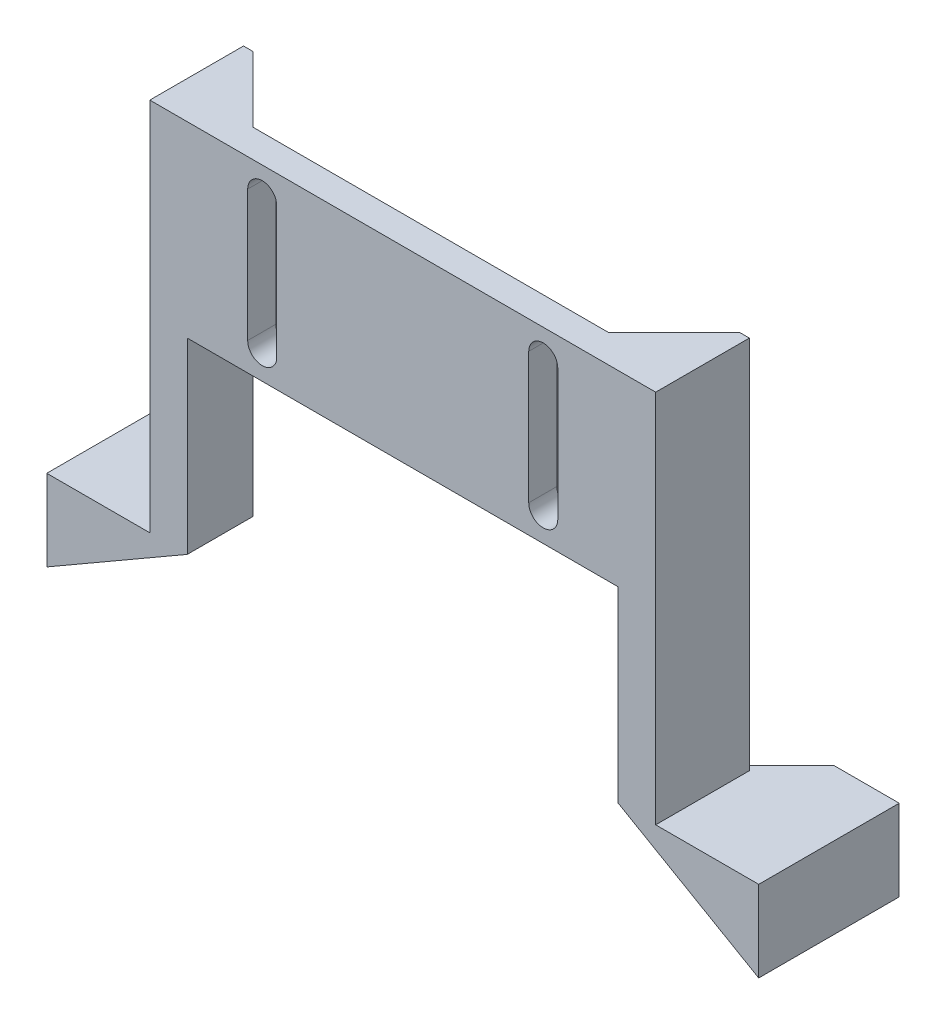
from build123d import *

# Parameters (mm, degrees)
SKETCH1_W                = 46
SKETCH1_H                = 20
BOSS_EXTRUDE1_DEPTH      = 10
BOSS_EXTRUDE2_DEPTH      = 5
BOSS_EXTRUDE2_DEPTH_BACK = 10
SKETCH3_W                = 38
SKETCH3_H                = 20
CUT_EXTRUDE1_DEPTH       = 7
CHAMFER1_START           = -38.660254038
CHAMFER1_DEPTH           = 48.660254038


with BuildPart() as part:
    # Sketch1 → Boss-Extrude1 (new body)
    # profile 1 of 3: a face of its own
    with BuildSketch(Plane.XY):
        Rectangle(SKETCH1_W, SKETCH1_H)
        with BuildLine():
            Line((-13.45, 7), (-13.45, 0))
            Line((-13.45, 0), (-13.45, -7))
            ThreePointArc((-13.45, -7), (-15, -8.55), (-16.55, -7))
            Line((-16.55, -7), (-16.55, -2.8e-08))
            Line((-16.55, -2.8e-08), (-16.55, 7))
            ThreePointArc((-16.55, 7), (-15, 8.55), (-13.45, 7))
        make_face(mode=Mode.SUBTRACT)
        with BuildLine():
            Line((13.45, -7), (13.45, -7e-09))
            Line((13.45, -7e-09), (13.45, 7))
            ThreePointArc((13.45, 7), (15, 8.55), (16.55, 7))
            Line((16.55, 7), (16.55, 0))
            Line((16.55, 0), (16.55, -7))
            ThreePointArc((16.55, -7), (15, -8.55), (13.45, -7))
        make_face(mode=Mode.SUBTRACT)
    # profile 2 of 3: a face of its own
    with BuildSketch(Plane.XY):
        Polygon((-23, -30), (-23, -10), (-23, 10), (-27, 10), (-27, -30), align=None)
    # profile 3 of 3: a face of its own
    with BuildSketch(Plane.XY):
        Polygon((23, 10), (23, -10), (23, -30), (27, -30), (27, 10), align=None)
    extrude(amount=BOSS_EXTRUDE1_DEPTH)

    # Sketch2 → Boss-Extrude2 (add, two sides: drawn at the far end of the back side and taken through both)
    with BuildSketch(Plane(origin=(0, 0, 0), x_dir=(-1, 0, 0), z_dir=(0, 0, -1)).offset(-BOSS_EXTRUDE2_DEPTH_BACK)):
        Polygon((-23, -30), (-38, -38.660254038), (-38, -30), align=None)
        Polygon((23, -30), (38, -38.660254038), (38, -30), align=None)
    extrude(amount=BOSS_EXTRUDE2_DEPTH + BOSS_EXTRUDE2_DEPTH_BACK)

    # Sketch3 → Cut-Extrude1 (cut)
    with BuildSketch(Plane(origin=(0, 0, 0), x_dir=(-1, 0, 0), z_dir=(0, 0, -1))):
        Rectangle(SKETCH3_W, SKETCH3_H)
    extrude(amount=-CUT_EXTRUDE1_DEPTH, mode=Mode.SUBTRACT)

    # Chamfer1: read off the stored shape, not the designer's step
    # Chamfer1 outline → Chamfer1 (cut)
    with BuildSketch(Plane(origin=(0, 0, 0), x_dir=(1, 0, 0), z_dir=(0, 1, 0)).offset(CHAMFER1_START)):
        Polygon((-23, 5), (-31, 5), (-19, -7), (-19, 0), (-23, 0), align=None)
        Polygon((31, 5), (23, 5), (23, 0), (19, 0), (19, -7), align=None)
    extrude(amount=CHAMFER1_DEPTH, mode=Mode.SUBTRACT)


solid = part.part
